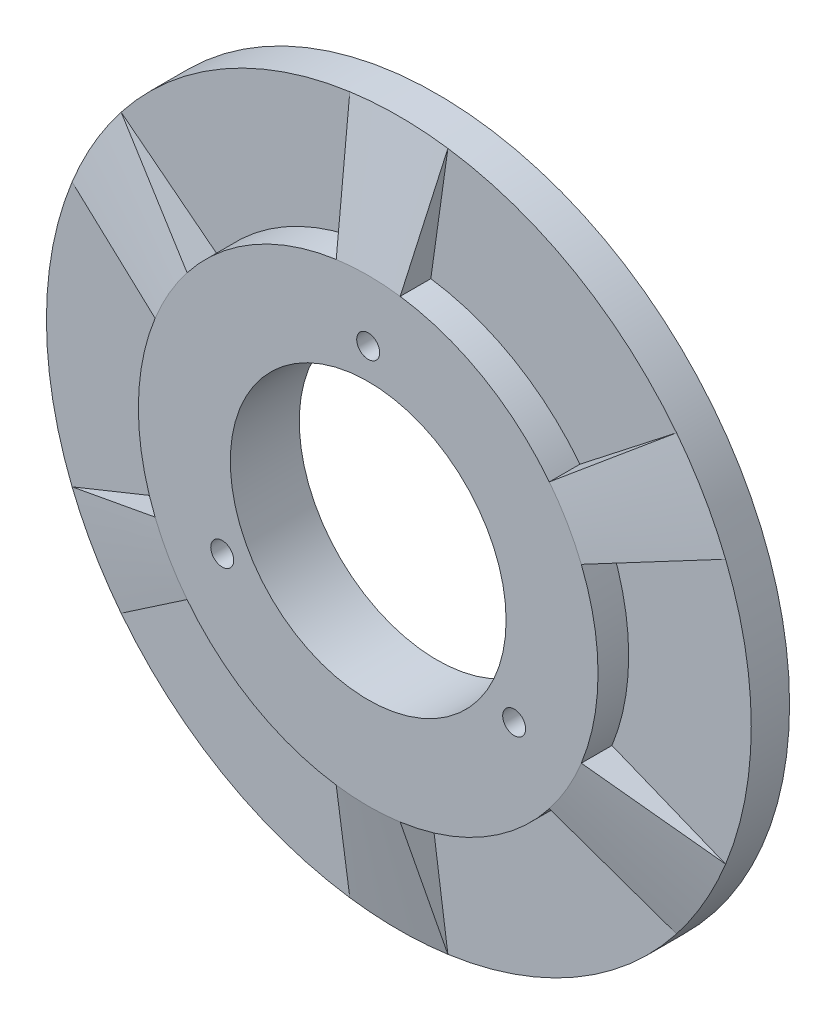
from build123d import *

# Parameters (mm, degrees)
SKETCH2_R               = 46
SKETCH2_R_2             = 18
BOSS_EXTRUDE2_DEPTH     = 5
SKETCH4_R               = 30
SKETCH4_R_2             = 18
BOSS_EXTRUDE3_DEPTH     = 4
CUT_EXTRUDE1_DEPTH      = 66.673434507
CUT_EXTRUDE1_DEPTH_BACK = 66.673434507
SKETCH5_R               = 1.5
REVOLVE1_ANGLE          = 16
CIRPATTERN1_COUNT       = 6


with BuildPart() as part:
    # Sketch2 → Boss-Extrude2 (new body)
    with BuildSketch(Plane.XY):
        Circle(SKETCH2_R)
        Circle(SKETCH2_R_2, mode=Mode.SUBTRACT)
    extrude(amount=BOSS_EXTRUDE2_DEPTH)

    # Sketch4 → Boss-Extrude3 (add)
    with BuildSketch(Plane.XY.offset(5)):
        Circle(SKETCH4_R)
        Circle(SKETCH4_R_2, mode=Mode.SUBTRACT)
    extrude(amount=BOSS_EXTRUDE3_DEPTH)

    # Sketch5 → Cut-Extrude1 (cut, two sides: drawn at the far end of the back side and taken through both)
    with BuildSketch(Plane(origin=(0, 0, 0), x_dir=(-1, 0, 0), z_dir=(0, 0, -1)).offset(-CUT_EXTRUDE1_DEPTH_BACK)):
        with Locations((0, 22)):
            Circle(SKETCH5_R)
        with Locations((19.052558883, -11)):
            Circle(SKETCH5_R)
        with Locations((-19.052558883, -11)):
            Circle(SKETCH5_R)
    extrude(amount=CUT_EXTRUDE1_DEPTH + CUT_EXTRUDE1_DEPTH_BACK, mode=Mode.SUBTRACT)

    # Sketch6 → Revolve1 (revolve, symmetric)
    with BuildSketch(Plane(origin=(0, 0, 0), x_dir=(0, 0, -1), z_dir=(1, 0, 0))) as revolve1_sk:
        Polygon((-5, 30), (-9, 30), (-5, 46), align=None)
    revolve1 = revolve(axis=Axis((0, 0, 0), (0, 0, -1)), revolution_arc=REVOLVE1_ANGLE / 2)
    revolve1 = revolve1 + revolve(revolve1_sk.sketch, axis=Axis((0, 0, 0), (0, 0, 1)), revolution_arc=REVOLVE1_ANGLE / 2)

    # CirPattern1: Revolve1 ×6 about axis
    cirpattern1_axis = Axis((0, 0, 9), (0, 0, 1))
    for i in range(1, CIRPATTERN1_COUNT):
        add(revolve1.rotate(cirpattern1_axis, i * 360 / CIRPATTERN1_COUNT))


solid = part.part
